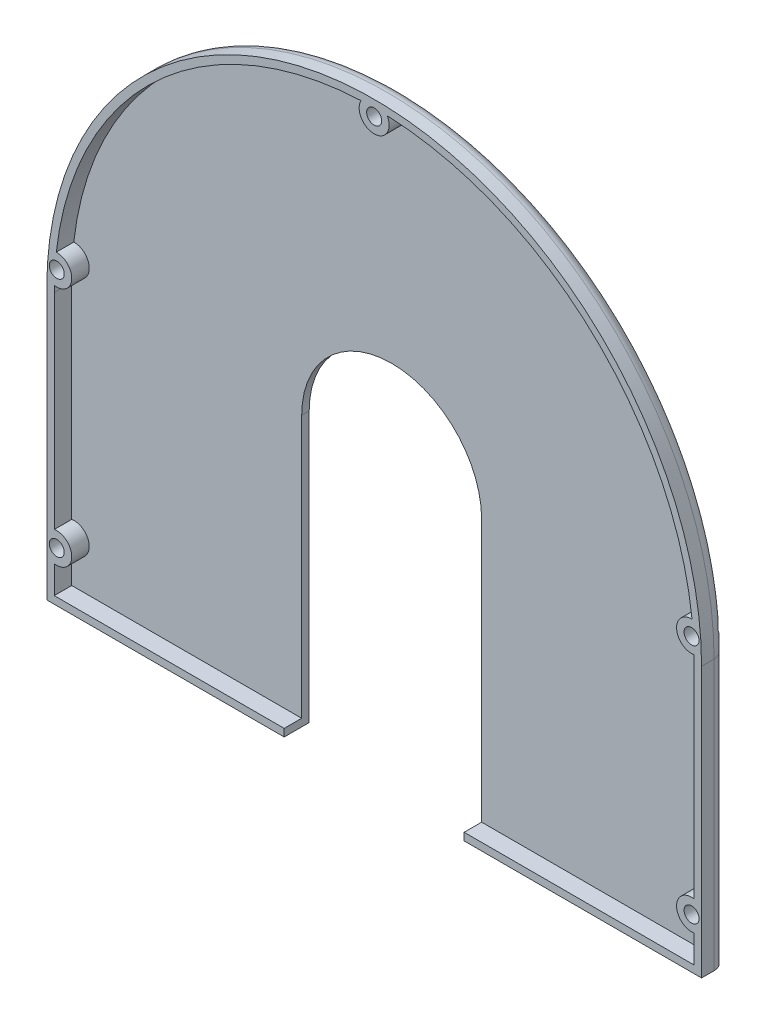
from build123d import *

# Parameters (mm, degrees)
SKETCH3_W                    = 131
SKETCH3_H                    = 54
BOSS_EXTRUDE2_DEPTH          = 5
F_3_0_3_DIAMETER_HOLE1_D     = 3
F_3_0_3_DIAMETER_HOLE1_DEPTH = 20
F_3_0_3_DIAMETER_HOLE1_TIP   = 0.901290929
SHELL1_T                     = -1.5
CUT_EXTRUDE1_DEPTH           = 114.452633288
FILLET2_START                = -28
FILLET2_DEPTH                = 120.497573337
FILLET2_2_ANGLE              = 180


with BuildPart() as part:
    # Sketch3 → Boss-Extrude2 (new body)
    with BuildSketch(Plane.XY):
        with BuildLine():
            Line((-65.5, 27), (65.5, 27))
            ThreePointArc((65.5, 27), (0, 92.5), (-65.5, 27))
        make_face()
        Rectangle(SKETCH3_W, SKETCH3_H)
    extrude(amount=BOSS_EXTRUDE2_DEPTH)

    # Ø3.0 (3) Diameter Hole1
    with Locations(Plane.XY.offset(5)):
        with Locations((-63.5, -17), (63.5, -17), (0, 89.5), (63.5, 31.210132452), (-63.5, 31.210132452)):
            Hole(F_3_0_3_DIAMETER_HOLE1_D / 2, depth=F_3_0_3_DIAMETER_HOLE1_DEPTH)
            with Locations((0, 0, -(F_3_0_3_DIAMETER_HOLE1_DEPTH + F_3_0_3_DIAMETER_HOLE1_TIP / 2))):  # 118° drill point
                Cone(0, F_3_0_3_DIAMETER_HOLE1_D / 2, F_3_0_3_DIAMETER_HOLE1_TIP, mode=Mode.SUBTRACT)

    # Shell1
    shell1_openings = [part.faces().sort_by_distance(p)[0] for p in [
        (0, 26.743328941, 5),
    ]]
    offset(amount=SHELL1_T, openings=shell1_openings)

    # Sketch6 → Cut-Extrude1 (cut, through all)
    with BuildSketch(Plane(origin=(0, 0, 0), x_dir=(-1, 0, 0), z_dir=(0, 0, -1))):
        with BuildLine():
            Line((-18, 27), (-18, -27))
            Line((-18, -27), (18, -27))
            Line((18, -27), (18, 27))
            ThreePointArc((18, 27), (0, 45), (-18, 27))
        make_face()
    extrude(amount=-CUT_EXTRUDE1_DEPTH, mode=Mode.SUBTRACT)

    # Fillet2: read off the stored shape, not the designer's step
    # Fillet2 outline → Fillet2 (cut)
    with BuildSketch(Plane(origin=(0, 0, 0), x_dir=(1, 0, 0), z_dir=(0, 1, 0)).offset(FILLET2_START)):
        with BuildLine():
            ThreePointArc((-65.5, -2.5), (-64.767766953, -0.732233047), (-63, 0))
            Line((-63, 0), (-65.5, 0))
            Line((-65.5, 0), (-65.5, -2.5))
        make_face()
        with BuildLine():
            ThreePointArc((63, 0), (64.767766953, -0.732233047), (65.5, -2.5))
            Line((65.5, -2.5), (65.5, 0))
            Line((65.5, 0), (63, 0))
        make_face()
    extrude(amount=FILLET2_DEPTH, mode=Mode.SUBTRACT)

    # Fillet2 2 outline → Fillet2 2 (revolve, cut)
    with BuildSketch(Plane.XZ.offset(-27)):
        with BuildLine():
            ThreePointArc((65.5, 2.5), (64.767766953, 0.732233047), (63, 0))
            Line((63, 0), (65.5, 0))
            Line((65.5, 0), (65.5, 2.5))
        make_face()
    revolve(axis=Axis((0, 27, 0), (0, 0, 1)), revolution_arc=FILLET2_2_ANGLE, mode=Mode.SUBTRACT)


solid = part.part
